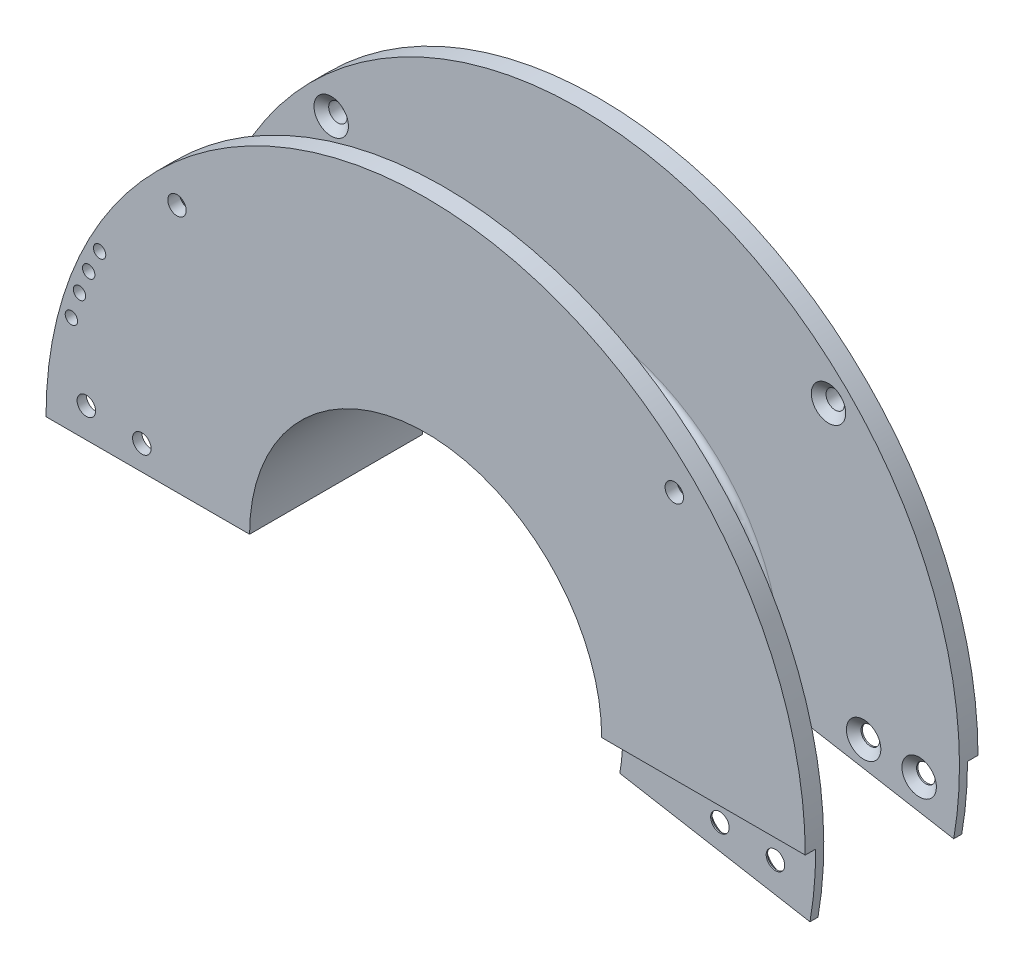
from build123d import *
from build123d.topology import SkipClean

# Parameters (mm, degrees)
REVOLVE8_ANGLE                              = 180
REVOLVE9_ANGLE                              = 10
CUT_REVOLVE1_ANGLE                          = 10.01
SKETCH4_R                                   = 1.905
CUT_EXTRUDE1_DEPTH                          = 142.330470109
CSK_FOR_6_FLAT_HEAD_MACHINE_SCREW_2_COUNT   = 2
CSK_FOR_6_FLAT_HEAD_MACHINE_SCREW_2_PITCH   = 11.473660743
SKETCH6_R                                   = 1.905
CUT_EXTRUDE3_DEPTH                          = 143.234851149
CUT_EXTRUDE4_START                          = -1.651
CUT_EXTRUDE4_OUTLINE_R                      = 1.905
CUT_EXTRUDE4_DEPTH                          = 1.651
CSK_FOR_6_FLAT_HEAD_MACHINE_SCREW_3_A_COUNT = 2
CSK_FOR_6_FLAT_HEAD_MACHINE_SCREW_3_A_PITCH = 11.473660743
SKETCH9_R                                   = 1.27
CUT_EXTRUDE5_DEPTH                          = 143.234851149
SKETCH10_R                                  = 1.8288
CUT_EXTRUDE7_DEPTH                          = 143.234851149
CIRPATTERN1_COUNT                           = 4


# Read off the part's stored shape, not the designer's step: Cut-Extrude4, CSK for #6 Flat Head Machine Screw (100)3
with BuildPart() as part:
    # Sketch1 → Revolve8 (revolve)
    with BuildSketch(Plane(origin=(0, 0, 0), x_dir=(1, 0, 0), z_dir=(0, 1, 0))):
        with BuildLine():
            Line((-42.91, 4.059999872), (-1, 4.059999872))
            Line((-1, 4.059999872), (-1, -31.500000128))
            Line((-1, -31.500000128), (-42.91, -31.500000128))
            Line((-42.91, -31.500000128), (-42.91, -27.690000128))
            Line((-42.91, -27.690000128), (-6.08, -27.690000128))
            ThreePointArc((-6.08, -27.690000128), (-5.181974388, -27.31802574), (-4.81, -26.420000128))
            Line((-4.81, -26.420000128), (-4.81, -1.020000128))
            ThreePointArc((-4.81, -1.020000128), (-5.181974388, -0.121974516), (-6.08, 0.249999872))
            Line((-6.08, 0.249999872), (-42.91, 0.249999872))
            Line((-42.91, 0.249999872), (-42.91, 4.059999872))
        make_face()
    revolve(axis=Axis((35.2425, 0, 32.45), (0, 0, -1)), revolution_arc=REVOLVE8_ANGLE)

    # Sketch2 → Revolve9 (revolve)
    with SkipClean():  # the faces are left unmerged after this step: merging them gives an invalid solid
        with BuildSketch(Plane.XZ):
            with BuildLine():
                Line((113.395, 27.690000128), (113.395, 29.341000128))
                Line((113.395, 29.341000128), (73.644, 29.341000128))
                Line((73.644, 29.341000128), (73.644, -1.900999872))
                Line((73.644, -1.900999872), (113.395, -1.900999872))
                Line((113.395, -1.900999872), (113.395, -0.249999872))
                Line((113.395, -0.249999872), (76.565, -0.249999872))
                ThreePointArc((76.565, -0.249999872), (75.666974388, 0.121974516), (75.295, 1.020000128))
                Line((75.295, 1.020000128), (75.295, 26.420000128))
                ThreePointArc((75.295, 26.420000128), (75.666974388, 27.31802574), (76.565, 27.690000128))
                Line((76.565, 27.690000128), (113.395, 27.690000128))
            make_face()
        revolve(axis=Axis((35.2425, 0, 32.45), (0, 0, -1)), revolution_arc=REVOLVE9_ANGLE)

    # Sketch3 → Cut-Revolve1 (revolve, cut)
    with SkipClean():  # the faces are left unmerged after this step: merging them gives an invalid solid
        with BuildSketch(Plane.XZ):
            with BuildLine():
                Line((-42.91, 27.690000128), (-42.91, 29.595000128))
                Line((-42.91, 29.595000128), (-2.905, 29.595000128))
                Line((-2.905, 29.595000128), (-2.905, -2.154999872))
                Line((-2.905, -2.154999872), (-42.91, -2.154999872))
                Line((-42.91, -2.154999872), (-42.91, -0.249999872))
                Line((-42.91, -0.249999872), (-6.08, -0.249999872))
                ThreePointArc((-6.08, -0.249999872), (-5.181974388, 0.121974516), (-4.81, 1.020000128))
                Line((-4.81, 1.020000128), (-4.81, 26.420000128))
                ThreePointArc((-4.81, 26.420000128), (-5.181974388, 27.31802574), (-6.08, 27.690000128))
                Line((-6.08, 27.690000128), (-42.91, 27.690000128))
            make_face()
        revolve(axis=Axis((35.2425, 0, 32.45), (0, 0, -1)), revolution_arc=CUT_REVOLVE1_ANGLE, mode=Mode.SUBTRACT)

    # Sketch4 → Cut-Extrude1 (cut, through all)
    with SkipClean():  # the faces are left unmerged after this step: merging them gives an invalid solid
        with BuildSketch(Plane(origin=(0, 0, 27.690000128), x_dir=(-1, 0, 0), z_dir=(0, 0, -1))):
            with Locations((-105.0925, -6.111083147)):
                Circle(SKETCH4_R)
            with Locations((-93.6625, -5.111087723)):
                Circle(SKETCH4_R)
        extrude(amount=-CUT_EXTRUDE1_DEPTH, mode=Mode.SUBTRACT)

    # Sketch5 → CSK for _6 Flat Head Machine Screw _100 (revolve, cut)
    with SkipClean():  # the faces are left unmerged after this step: merging them gives an invalid solid
        with BuildSketch(Plane(origin=(105.0925, -6.111083147, 27.690000128), x_dir=(0, 1, 0), z_dir=(1, 0, 0))):
            Polygon((0, 0), (0, 2.410824014), (1.89865, 1.27), (1.89865, 1.380025208), (3.5433, 0), align=None)
        csk_for_6_flat_head_machine_screw_100 = revolve(axis=Axis((105.0925, -6.111083147, 21.340000128), (0, 0, 1)), mode=Mode.SUBTRACT)

    # CSK for _6 Flat Head Machine Screw _ 2: CSK for _6 Flat Head Machine Screw _100 ×2
    with SkipClean():  # the faces are left unmerged after this step: merging them gives an invalid solid
        with Locations(*[Vector(-0.9961946980917443, 0.08715574274767204, 0) * (i * CSK_FOR_6_FLAT_HEAD_MACHINE_SCREW_2_PITCH) for i in range(1, CSK_FOR_6_FLAT_HEAD_MACHINE_SCREW_2_COUNT)]):
            add(csk_for_6_flat_head_machine_screw_100, mode=Mode.SUBTRACT)

    # Sketch6 → Cut-Extrude3 (cut, through all)
    with SkipClean():  # the faces are left unmerged after this step: merging them gives an invalid solid
        with BuildSketch(Plane.XY.offset(31.500000128)):
            with Locations((-34.6075, 6.111083147)):
                Circle(SKETCH6_R)
            with Locations((-23.1775, 5.111087723)):
                Circle(SKETCH6_R)
        extrude(amount=-CUT_EXTRUDE3_DEPTH, mode=Mode.SUBTRACT)

    # Cut-Extrude4 outline → Cut-Extrude4 (cut)
    with SkipClean():  # the faces are left unmerged after this step: merging them gives an invalid solid
        with BuildSketch(Plane.XY.offset(-0.249999872).offset(CUT_EXTRUDE4_START)):
            with Locations((93.6625, -5.111087723)):
                Circle(CUT_EXTRUDE4_OUTLINE_R)
            with Locations((105.0925, -6.111083147)):
                Circle(CUT_EXTRUDE4_OUTLINE_R)
        extrude(amount=CUT_EXTRUDE4_DEPTH, mode=Mode.SUBTRACT)

    # Sketch8 → CSK for _6 Flat Head Machine Screw _ 3 (revolve, cut)
    with SkipClean():  # the faces are left unmerged after this step: merging them gives an invalid solid
        with BuildSketch(Plane(origin=(105.0925, -6.111083147, -0.249999872), x_dir=(0, -1, 0), z_dir=(1, 0, 0))):
            Polygon((0, 0), (0, 2.410824014), (1.89865, 1.27), (1.89865, 1.380025208), (3.5433, 0), align=None)
        csk_for_6_flat_head_machine_screw_3 = revolve(axis=Axis((105.0925, -6.111083147, 6.100000128), (0, 0, -1)), mode=Mode.SUBTRACT)

    # CSK for _6 Flat Head Machine Screw _ 3 a: CSK for _6 Flat Head Machine Screw _ 3 ×2
    with SkipClean():  # the faces are left unmerged after this step: merging them gives an invalid solid
        with Locations(*[Vector(-0.9961946980917443, 0.08715574274767204, 0) * (i * CSK_FOR_6_FLAT_HEAD_MACHINE_SCREW_3_A_PITCH) for i in range(1, CSK_FOR_6_FLAT_HEAD_MACHINE_SCREW_3_A_COUNT)]):
            add(csk_for_6_flat_head_machine_screw_3, mode=Mode.SUBTRACT)

    # Sketch9 → Cut-Extrude5 (cut, through all)
    with SkipClean():  # the faces are left unmerged after this step: merging them gives an invalid solid
        with BuildSketch(Plane(origin=(0, 0, -4.059999872), x_dir=(-1, 0, 0), z_dir=(0, 0, -1))):
            with Locations((37.685424405, 20.268120435)):
                Circle(SKETCH9_R)
            with Locations((36.012724032, 25.533740661)):
                Circle(SKETCH9_R)
            with Locations((34.117636914, 30.305944487)):
                Circle(SKETCH9_R)
            with Locations((31.875478148, 34.992225899)):
                Circle(SKETCH9_R)
        extrude(amount=-CUT_EXTRUDE5_DEPTH, mode=Mode.SUBTRACT)

    # Sketch10 → Cut-Extrude7 (cut, through all)
    with SkipClean():  # the faces are left unmerged after this step: merging them gives an invalid solid
        with BuildSketch(Plane(origin=(0, 0, 31.500000128), x_dir=(-1, 0, 0), z_dir=(0, 0, -1))):
            with Locations(Location((15.94495989, 51.18745989, 0), (0, 0, 180))):
                Circle(SKETCH10_R)
        cut_extrude7 = extrude(amount=CUT_EXTRUDE7_DEPTH, mode=Mode.SUBTRACT)

    # CirPattern1: Cut-Extrude7 ×4 about axis
    with SkipClean():  # the faces are left unmerged after this step: merging them gives an invalid solid
        cirpattern1_axis = Axis((35.2425, 0, 32.45), (0, 0, -1))
        for i in range(1, CIRPATTERN1_COUNT):
            add(cut_extrude7.rotate(cirpattern1_axis, i * 360 / CIRPATTERN1_COUNT), mode=Mode.SUBTRACT)

    # CSK for _6 Flat Head Machine Screw _ 4 o → CSK for _6 Flat Head Machine Screw _ 4 (revolve, cut)
    with SkipClean():  # the faces are left unmerged after this step: merging them gives an invalid solid
        with BuildSketch(Plane(origin=(-15.94495989, 51.18745989, 0), x_dir=(1, 0, 0), z_dir=(0, -1, 0))):
            Polygon((1.8288, -4.059999872), (1.89865, -4.059999872), (1.89865, -1.63002508), (3.5433, -0.249999872), (1.8288, -0.249999872), align=None)
            Polygon((3.5433, 27.690000128), (1.89865, 29.070025336), (1.89865, 31.500000128), (1.8288, 31.500000128), (1.8288, 27.690000128), align=None)
        revolve(axis=Axis((-15.94495989, 51.18745989, 0), (0, 0, 1)), mode=Mode.SUBTRACT)

    # CSK for _6 Flat Head Machine Screw _ 5 → CSK for _6 Flat Head Machine Screw _ 4 2 (revolve, cut)
    with SkipClean():  # the faces are left unmerged after this step: merging them gives an invalid solid
        with BuildSketch(Plane(origin=(86.42995989, 51.18745989, 0), x_dir=(1, 0, 0), z_dir=(0, -1, 0))):
            Polygon((1.8288, -4.059999872), (1.89865, -4.059999872), (1.89865, -1.63002508), (3.5433, -0.249999872), (1.8288, -0.249999872), align=None)
            Polygon((3.5433, 27.690000128), (1.89865, 29.070025336), (1.89865, 31.500000128), (1.8288, 31.500000128), (1.8288, 27.690000128), align=None)
        revolve(axis=Axis((86.42995989, 51.18745989, 0), (0, 0, 1)), mode=Mode.SUBTRACT)


solid = part.part
